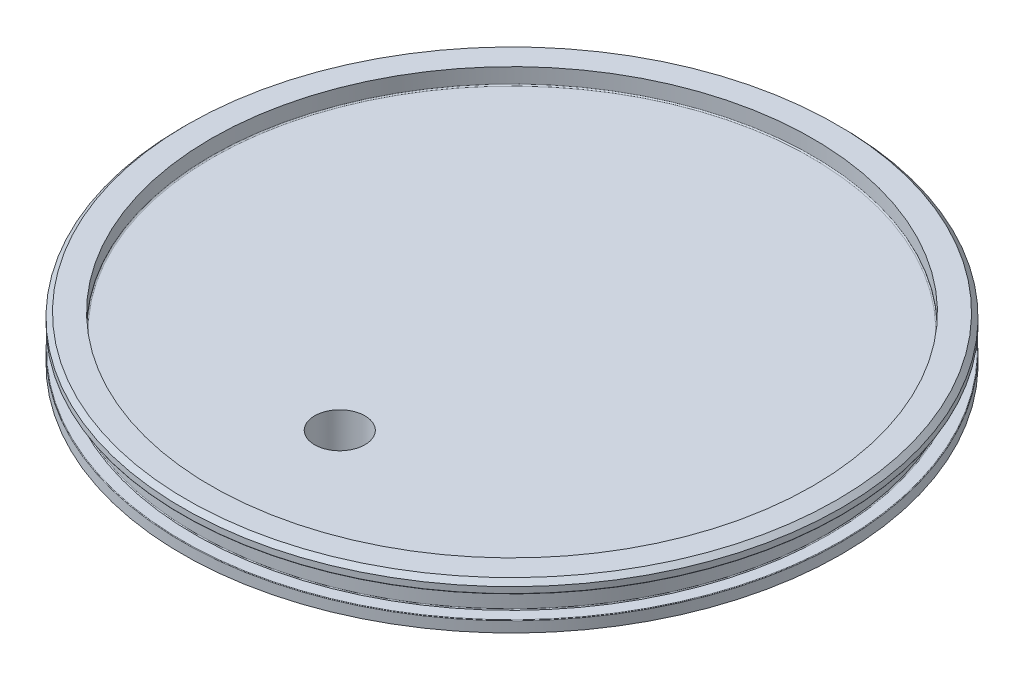
from build123d import *

# Parameters (mm, degrees)
SKETCH6_R                                = 66.04
BOSS_EXTRUDE1_DEPTH                      = 2.54
CNC_ID_FILLET_R                          = 0.1778
CNC_OD_FILLET_R                          = 0.127
CNC_CHAMFERS_SIZE                        = 1.016
CNC_BORE_FILLET_R                        = 0.254
PIPE_TAP_DRILL_FOR_1_4_TAP_TO_INJECTOR_D = 11.1252


with BuildPart() as part:
    # Sketch1 → Revolve1 (revolve)
    with BuildSketch(Plane.XY):
        Polygon((0, 0), (72.898, 0), (72.898, 2.4638), (70.0532, 2.4638), (70.0532, 7.4422), (72.898, 7.4422), (72.898, 9.906), (66.548, 9.906), (66.548, 6.35), (0, 6.35), align=None)
    revolve(axis=Axis((0, 48.192213231, 0), (0, -1, 0)))

    # Sketch6 → Boss-Extrude1 (add)
    with BuildSketch(Plane.XZ):
        Circle(SKETCH6_R)
    extrude(amount=BOSS_EXTRUDE1_DEPTH)

    # CNC ID Fillet
    cnc_id_fillet_edges = [part.edges().sort_by_distance(p)[0] for p in [
        (-70.0532, 7.4422, 0),
        (-70.0532, 2.4638, 0),
        (-66.04, 0, 0),
    ]]
    fillet(cnc_id_fillet_edges, radius=CNC_ID_FILLET_R)

    # CNC OD Fillet
    cnc_od_fillet_edges = [part.edges().sort_by_distance(p)[0] for p in [
        (-72.898, 7.4422, 0),
        (-72.898, 2.4638, 0),
        (-66.04, -2.54, 0),
    ]]
    fillet(cnc_od_fillet_edges, radius=CNC_OD_FILLET_R)

    # CNC Chamfers
    cnc_chamfers_edges = [part.edges().sort_by_distance(p)[0] for p in [
        (-72.898, 9.906, 0),
    ]]
    chamfer(cnc_chamfers_edges, length=CNC_CHAMFERS_SIZE)

    # CNC Bore Fillet
    cnc_bore_fillet_edges = [part.edges().sort_by_distance(p)[0] for p in [
        (-66.548, 6.35, 0),
    ]]
    fillet(cnc_bore_fillet_edges, radius=CNC_BORE_FILLET_R)

    # Pipe Tap Drill for 1/4 Tap - To Injector (through all)
    with Locations(Plane(origin=(0, -2.54, 0), x_dir=(-1, 0, 0), z_dir=(0, -1, 0))):
        with Locations((0, -38.1)):
            Hole(PIPE_TAP_DRILL_FOR_1_4_TAP_TO_INJECTOR_D / 2)


solid = part.part
